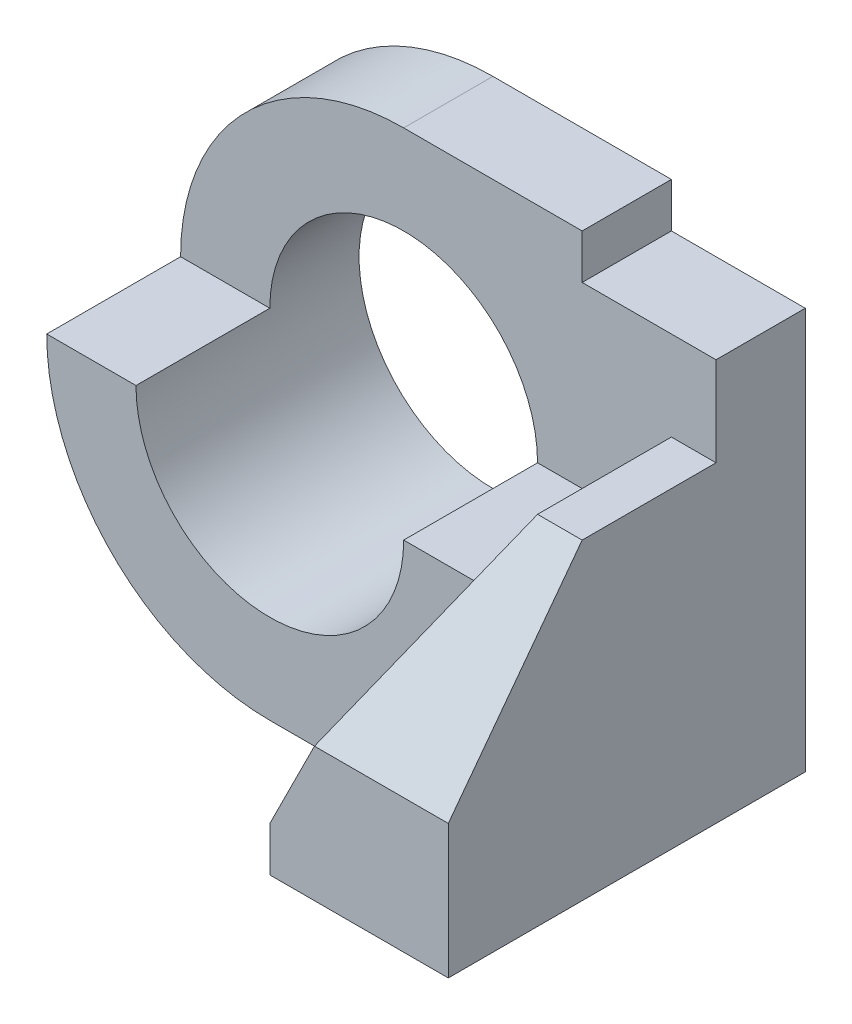
from build123d import *

# Parameters (mm, degrees)
SKETCH1_R           = 3
BOSS_EXTRUDE1_DEPTH = 5
SKETCH2_W           = 14.277681963
SKETCH2_H           = 5.610279578
CUT_EXTRUDE1_DEPTH  = 3
BOSS_EXTRUDE2_DEPTH = 6
CHAMFER1_SIZE       = 3
CHAMFER1_SIZE2      = 4


with BuildPart() as part:
    # Sketch1 → Boss-Extrude1 (new body)
    with BuildSketch(Plane.XY):
        with BuildLine():
            Line((0, 0), (7, 0))
            Line((7, 0), (7, 9))
            Line((7, 9), (4, 9))
            Line((4, 9), (4, 10))
            Line((4, 10), (0, 10))
            ThreePointArc((0, 10), (-5, 5), (0, 0))
        make_face()
        with Locations((0, 5)):
            Circle(SKETCH1_R, mode=Mode.SUBTRACT)
    extrude(amount=BOSS_EXTRUDE1_DEPTH)

    # Sketch2 → Cut-Extrude1 (cut)
    with BuildSketch(Plane.XY.offset(5)):
        with Locations((2.138840982, 7.805139789)):
            Rectangle(SKETCH2_W, SKETCH2_H)
    extrude(amount=-CUT_EXTRUDE1_DEPTH, mode=Mode.SUBTRACT)

    # Sketch3 → Boss-Extrude2 (add)
    with BuildSketch(Plane.XY.offset(2)):
        Polygon((7, 7), (6, 7), (3, 1), (3, 0), (7, 0), align=None)
    extrude(amount=BOSS_EXTRUDE2_DEPTH)

    # Chamfer1
    chamfer1_edges = [part.edges().sort_by_distance(p)[0] for p in [
        (6.5, 7, 8),
    ]]
    chamfer1_side = [part.faces().sort_by_distance(p)[0] for p in [
        (6.5, 7, 5),
    ]]
    chamfer(chamfer1_edges, length=CHAMFER1_SIZE, length2=CHAMFER1_SIZE2, reference=chamfer1_side[0])


solid = part.part
